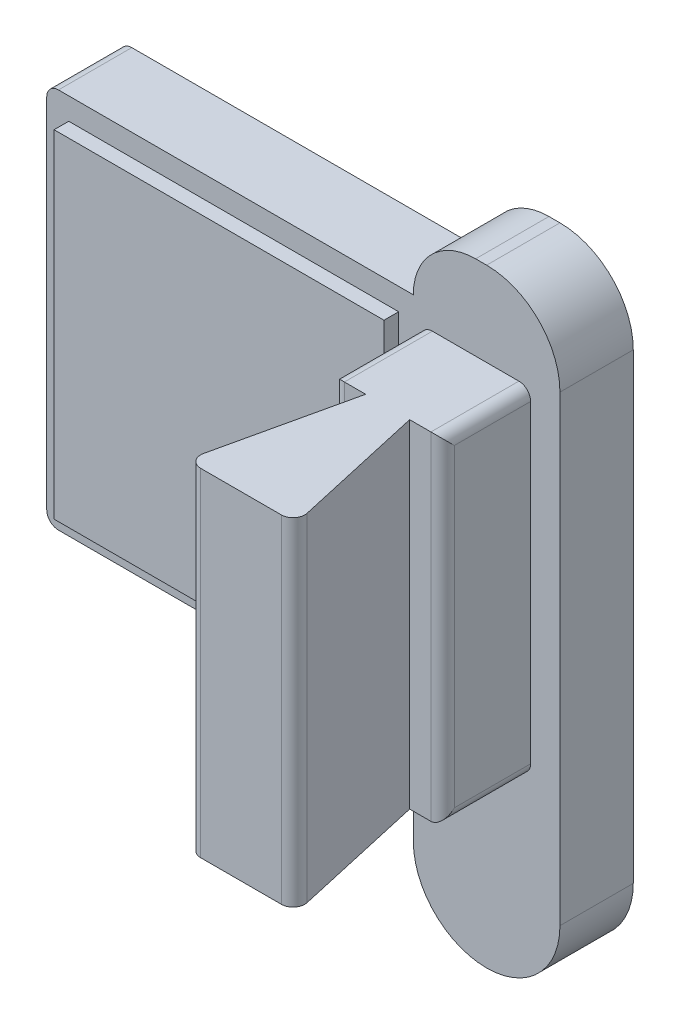
from build123d import *

# Parameters (mm, degrees)
SKETCH1_R           = 1.45
SKETCH1_W           = 4.5
SKETCH1_H           = 20
BOSS_EXTRUDE1_DEPTH = 5
SKETCH2_W           = 7.5
SKETCH2_H           = 23
SKETCH2_W_2         = 4.5
SKETCH2_H_2         = 20
BOSS_EXTRUDE2_DEPTH = 5
SKETCH3_W           = 7.5
SKETCH3_H           = 23
BOSS_EXTRUDE3_DEPTH = 1
CUT_EXTRUDE1_REACH  = 33.075
SKETCH6_R           = 1.25
SKETCH7_W           = 5
SKETCH7_H           = 26
BOSS_EXTRUDE4_DEPTH = 25
SKETCH8_W           = 22.5
SKETCH8_H           = 23
BOSS_EXTRUDE5_DEPTH = 1
BOSS_EXTRUDE6_DEPTH = 23
FILLET1_R           = 0.8
BOSS_EXTRUDE7_START = -5
BOSS_EXTRUDE7_DEPTH = 5
BOSS_EXTRUDE8_START = -5
BOSS_EXTRUDE8_DEPTH = 5
SKETCH12_R          = 3.15
CUT_EXTRUDE2_DEPTH  = 3.1
FILLET2_R           = 5
BOSS_EXTRUDE9_START = -0.4
SKETCH14_R          = 1.45
BOSS_EXTRUDE9_DEPTH = 0.4


with BuildPart() as part:
    # Sketch1 → Boss-Extrude1 (new body)
    with BuildSketch(Plane.XY):
        with BuildLine():
            Line((-4.25, 0), (-4.25, 26))
            ThreePointArc((-4.25, 26), (0, 30.25), (4.25, 26))
            Line((4.25, 26), (4.25, 0))
            ThreePointArc((4.25, 0), (0, -4.25), (-4.25, 0))
        make_face()
        with Locations((0, 26)):
            Circle(SKETCH1_R, mode=Mode.SUBTRACT)
        Circle(SKETCH1_R, mode=Mode.SUBTRACT)
        with Locations((0, 13)):
            Rectangle(SKETCH1_W, SKETCH1_H, mode=Mode.SUBTRACT)
    extrude(amount=BOSS_EXTRUDE1_DEPTH)

    # Sketch2 → Boss-Extrude2 (add)
    with BuildSketch(Plane.XY.offset(5)):
        with Locations((0, 13)):
            Rectangle(SKETCH2_W, SKETCH2_H)
        with Locations((0, 13)):
            Rectangle(SKETCH2_W_2, SKETCH2_H_2, mode=Mode.SUBTRACT)
    extrude(amount=BOSS_EXTRUDE2_DEPTH)

    # Sketch3 → Boss-Extrude3 (add)
    with BuildSketch(Plane.XY.offset(10)):
        with Locations((0, 13)):
            Rectangle(SKETCH3_W, SKETCH3_H)
    extrude(amount=BOSS_EXTRUDE3_DEPTH)

    # Sketch6 → Cut-Extrude1 (cut, up to next)
    with BuildSketch(Plane.XZ.offset(-1.5), mode=Mode.PRIVATE) as cut_extrude1_sk1:
        with Locations((0, 7.153891294)):
            Circle(SKETCH6_R)
    cut_extrude1_tool1 = extrude(cut_extrude1_sk1.sketch, amount=-CUT_EXTRUDE1_REACH, mode=Mode.PRIVATE) & part.part
    add(cut_extrude1_tool1.solids().sort_by_distance((0, 1.5, 7.153891))[0], mode=Mode.SUBTRACT)

    # Sketch7 → Boss-Extrude4 (add)
    with BuildSketch(Plane.ZY.offset(4.25)):
        with Locations((2.5, 13)):
            Rectangle(SKETCH7_W, SKETCH7_H)
    extrude(amount=BOSS_EXTRUDE4_DEPTH)

    # Sketch8 → Boss-Extrude5 (add)
    with BuildSketch(Plane.XY.offset(5)):
        with Locations((-16.5, 13)):
            Rectangle(SKETCH8_W, SKETCH8_H)
    extrude(amount=BOSS_EXTRUDE5_DEPTH)

    # Sketch10 → Boss-Extrude6 (add)
    with BuildSketch(Plane.XZ.offset(-1.5)):
        Polygon((-1.5, 11), (1.5, 11), (3.75, 21), (-3.75, 21), align=None)
    extrude(amount=-BOSS_EXTRUDE6_DEPTH)

    # Fillet1
    fillet1_edges = [part.edges().sort_by_distance(p)[0] for p in [
        (-3.75, 13, 21),
        (3.75, 13, 21),
        (-3.75, 1.5, 8),
        (3.75, 1.5, 8),
        (3.75, 24.5, 8),
        (-3.75, 24.5, 8),
        (-3.75, 13, 11),
        (3.75, 13, 11),
        (-29.25, 26, 2.5),
        (-29.25, 0, 2.5),
    ]]
    fillet(fillet1_edges, radius=FILLET1_R)

    # Sketch11 → Boss-Extrude7 (add)
    with BuildSketch(Plane.XY.offset(5).offset(BOSS_EXTRUDE7_START)):
        with BuildLine():
            Line((-4.25, 0), (-4.25, -11.262558254))
            Line((-4.25, -11.262558254), (4.25, -11.262558254))
            Line((4.25, -11.262558254), (4.25, 0))
            ThreePointArc((4.25, 0), (0, -4.25), (-4.25, 0))
        make_face()
    extrude(amount=BOSS_EXTRUDE7_DEPTH)

    # Sketch13 → Boss-Extrude8 (add)
    with BuildSketch(Plane.XY.offset(5).offset(BOSS_EXTRUDE8_START)):
        with BuildLine():
            Line((4.25, -11.262558254), (5.75, -11.262558254))
            Line((5.75, -11.262558254), (5.75, 30.25))
            Line((5.75, 30.25), (0, 30.25))
            ThreePointArc((0, 30.25), (3.00520382, 29.00520382), (4.25, 26))
            Line((4.25, 26), (4.25, -11.262558254))
        make_face()
    extrude(amount=BOSS_EXTRUDE8_DEPTH)

    # Sketch12 → Cut-Extrude2 (cut)
    with BuildSketch(Plane(origin=(0, 0, 0), x_dir=(-1, 0, 0), z_dir=(0, 0, -1))):
        with Locations((-1.6, -6.45)):
            Circle(SKETCH12_R)
    extrude(amount=-CUT_EXTRUDE2_DEPTH, mode=Mode.SUBTRACT)

    # Fillet2
    fillet2_edges = [part.edges().sort_by_distance(p)[0] for p in [
        (5.75, 30.25, 2.5),
        (5.75, -11.262558254, 2.5),
        (-4.25, -11.262558254, 2.5),
    ]]
    fillet(fillet2_edges, radius=FILLET2_R - 0.0001)  # a hair under: the kernel refuses the full size

    # Sketch14 → Boss-Extrude9 (add)
    with BuildSketch(Plane.XY.offset(5).offset(BOSS_EXTRUDE9_START)):
        with Locations((0, 26)):
            Circle(SKETCH14_R)
        Circle(SKETCH14_R)
    extrude(amount=BOSS_EXTRUDE9_DEPTH)


solid = part.part
